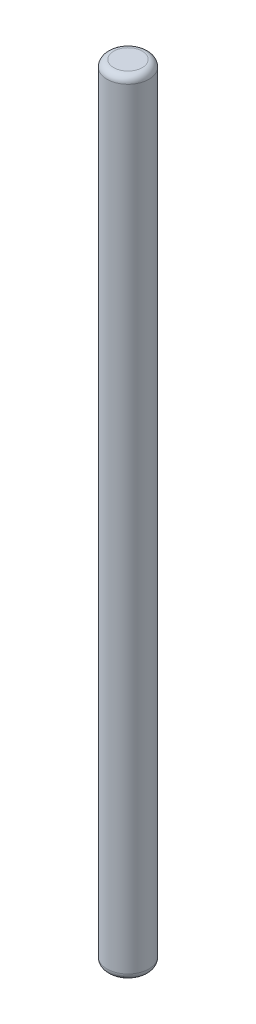
from build123d import *

# Parameters (mm, degrees)
SKETCH1_R           = 2.38125
BOSS_EXTRUDE1_DEPTH = 88.9
FILLET1_R           = 0.762


with BuildPart() as part:
    # Sketch1 → Boss-Extrude1 (new body)
    with BuildSketch(Plane(origin=(0, 0, 0), x_dir=(1, 0, 0), z_dir=(0, 1, 0))):
        Circle(SKETCH1_R)
    extrude(amount=BOSS_EXTRUDE1_DEPTH)

    # Fillet1
    fillet1_edges = [part.edges().sort_by_distance(p)[0] for p in [
        (-2.38125, 0, 0),
        (-2.38125, 88.9, 0),
    ]]
    fillet(fillet1_edges, radius=FILLET1_R)


solid = part.part
